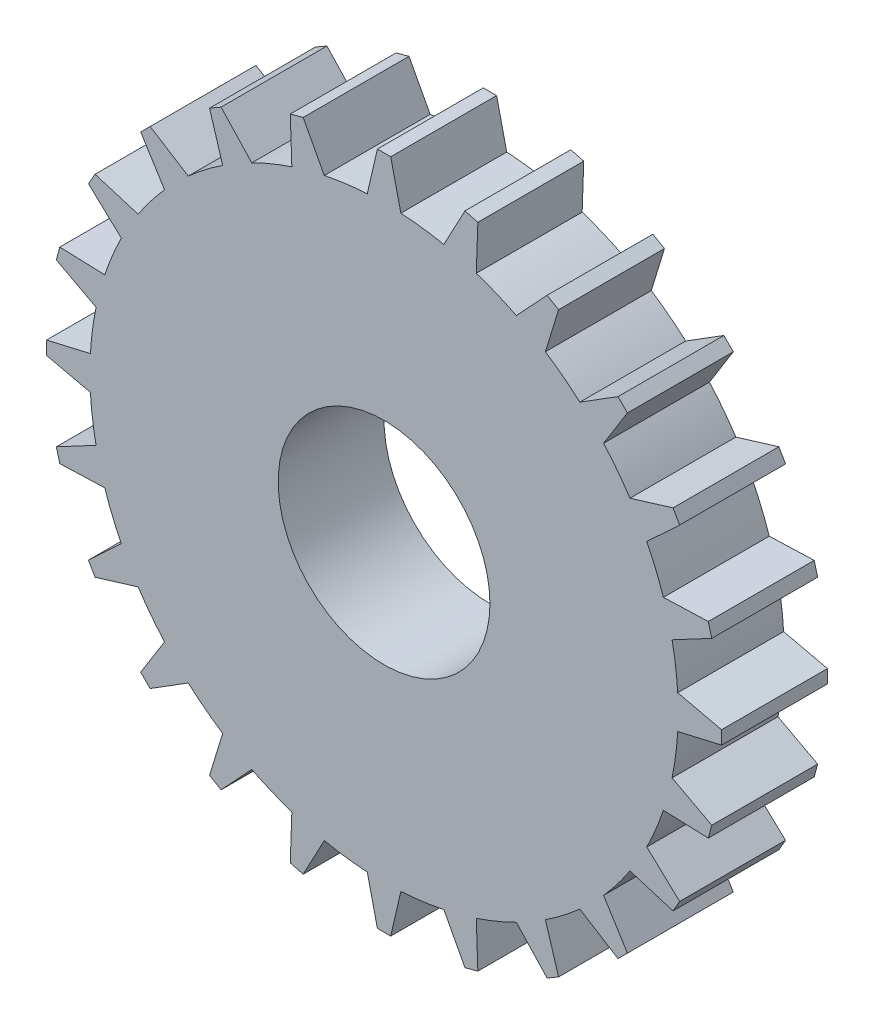
from build123d import *

# Parameters (mm, degrees)
CROQUIS1_R              = 44.1
CROQUIS1_R_2            = 15.875
SALIENTE_EXTRUIR1_DEPTH = 15.875
SALIENTE_EXTRUIR2_DEPTH = 15.875
MATRIZC1_DEPTH          = 15.875


# Read off the part's stored shape, not the designer's step: MatrizC1
with BuildPart() as part:
    # Croquis1 → Saliente-Extruir1 (new body)
    with BuildSketch(Plane.XY):
        Circle(CROQUIS1_R)
        Circle(CROQUIS1_R_2, mode=Mode.SUBTRACT)
    extrude(amount=SALIENTE_EXTRUIR1_DEPTH)

    # Croquis2 → Saliente-Extruir2 (add)
    with BuildSketch(Plane.XY.offset(15.875)):
        Polygon((-1, 50.6), (1, 50.6), (2.815859205, 42.731276779), (-2.815859205, 42.731276779), align=None)
    extrude(amount=-SALIENTE_EXTRUIR2_DEPTH)

    # MatrizC1 outline → MatrizC1 (add)
    with BuildSketch(Plane.XY):
        with BuildLine():
            ThreePointArc((-13.826153616, 41.876574313), (-11.413919889, 42.59732894), (-8.964486889, 43.179253987))
            Line((-8.964486889, 43.179253987), (-12.130317856, 49.134665855))
            Line((-12.130317856, 49.134665855), (-14.062169508, 48.617027765))
            Line((-14.062169508, 48.617027765), (-13.826153616, 41.876574313))
        make_face()
        with BuildLine():
            ThreePointArc((8.964486889, 43.179253987), (11.413919889, 42.59732894), (13.826153616, 41.876574313))
            Line((13.826153616, 41.876574313), (14.062169508, 48.617027765))
            Line((14.062169508, 48.617027765), (12.130317856, 49.134665855))
            Line((12.130317856, 49.134665855), (8.964486889, 43.179253987))
        make_face()
        with BuildLine():
            ThreePointArc((19.83464269, 39.387776649), (22.05, 38.191720307), (24.193493831, 36.87119277))
            Line((24.193493831, 36.87119277), (26.166025404, 43.320885431))
            Line((26.166025404, 43.320885431), (24.433974596, 44.320885431))
            Line((24.433974596, 44.320885431), (19.83464269, 39.387776649))
        make_face()
        with BuildLine():
            ThreePointArc((29.353100371, 32.912087424), (31.18340905, 31.18340905), (32.912087424, 29.353100371))
            Line((32.912087424, 29.353100371), (36.486709909, 35.072496347))
            Line((36.486709909, 35.072496347), (35.072496347, 36.486709909))
            Line((35.072496347, 36.486709909), (29.353100371, 32.912087424))
        make_face()
        with BuildLine():
            ThreePointArc((36.87119277, 24.193493831), (38.191720307, 22.05), (39.387776649, 19.83464269))
            Line((39.387776649, 19.83464269), (44.320885431, 24.433974596))
            Line((44.320885431, 24.433974596), (43.320885431, 26.166025404))
            Line((43.320885431, 26.166025404), (36.87119277, 24.193493831))
        make_face()
        with BuildLine():
            ThreePointArc((41.876574313, 13.826153616), (42.597328939, 11.413919889), (43.179253986, 8.964486889))
            Line((43.179253986, 8.964486889), (49.134665855, 12.130317856))
            Line((49.134665855, 12.130317856), (48.617027765, 14.062169508))
            Line((48.617027765, 14.062169508), (41.876574313, 13.826153616))
        make_face()
        with BuildLine():
            ThreePointArc((44.028136522, 2.51658388), (44.1, 0), (44.028136522, -2.51658388))
            Line((44.028136522, -2.51658388), (50.6, -1))
            Line((50.6, -1), (50.6, 1))
            Line((50.6, 1), (44.028136522, 2.51658388))
        make_face()
        with BuildLine():
            ThreePointArc((43.179253986, -8.964486889), (42.597328939, -11.413919889), (41.876574313, -13.826153616))
            Line((41.876574313, -13.826153616), (48.617027765, -14.062169508))
            Line((48.617027765, -14.062169508), (49.134665855, -12.130317856))
            Line((49.134665855, -12.130317856), (43.179253986, -8.964486889))
        make_face()
        with BuildLine():
            ThreePointArc((39.387776649, -19.83464269), (38.191720307, -22.05), (36.871192769, -24.193493831))
            Line((36.871192769, -24.193493831), (43.320885431, -26.166025404))
            Line((43.320885431, -26.166025404), (44.320885431, -24.433974596))
            Line((44.320885431, -24.433974596), (39.387776649, -19.83464269))
        make_face()
        with BuildLine():
            ThreePointArc((32.912087424, -29.353100371), (31.18340905, -31.18340905), (29.353100371, -32.912087424))
            Line((29.353100371, -32.912087424), (35.072496347, -36.486709909))
            Line((35.072496347, -36.486709909), (36.486709909, -35.072496347))
            Line((36.486709909, -35.072496347), (32.912087424, -29.353100371))
        make_face()
        with BuildLine():
            ThreePointArc((24.193493831, -36.871192769), (22.05, -38.191720307), (19.83464269, -39.387776649))
            Line((19.83464269, -39.387776649), (24.433974596, -44.320885431))
            Line((24.433974596, -44.320885431), (26.166025404, -43.320885431))
            Line((26.166025404, -43.320885431), (24.193493831, -36.871192769))
        make_face()
        with BuildLine():
            ThreePointArc((13.826153616, -41.876574313), (11.413919889, -42.597328939), (8.964486889, -43.179253986))
            Line((8.964486889, -43.179253986), (12.130317856, -49.134665855))
            Line((12.130317856, -49.134665855), (14.062169508, -48.617027765))
            Line((14.062169508, -48.617027765), (13.826153616, -41.876574313))
        make_face()
        with BuildLine():
            ThreePointArc((2.51658388, -44.028136522), (0, -44.1), (-2.51658388, -44.028136522))
            Line((-2.51658388, -44.028136522), (-1, -50.6))
            Line((-1, -50.6), (1, -50.6))
            Line((1, -50.6), (2.51658388, -44.028136522))
        make_face()
        with BuildLine():
            ThreePointArc((-8.964486889, -43.179253986), (-11.413919889, -42.597328939), (-13.826153616, -41.876574313))
            Line((-13.826153616, -41.876574313), (-14.062169508, -48.617027765))
            Line((-14.062169508, -48.617027765), (-12.130317856, -49.134665855))
            Line((-12.130317856, -49.134665855), (-8.964486889, -43.179253986))
        make_face()
        with BuildLine():
            ThreePointArc((-19.83464269, -39.387776649), (-22.05, -38.191720307), (-24.193493831, -36.871192769))
            Line((-24.193493831, -36.871192769), (-26.166025404, -43.320885431))
            Line((-26.166025404, -43.320885431), (-24.433974596, -44.320885431))
            Line((-24.433974596, -44.320885431), (-19.83464269, -39.387776649))
        make_face()
        with BuildLine():
            ThreePointArc((-29.353100371, -32.912087424), (-31.18340905, -31.18340905), (-32.912087424, -29.353100371))
            Line((-32.912087424, -29.353100371), (-36.486709909, -35.072496347))
            Line((-36.486709909, -35.072496347), (-35.072496347, -36.486709909))
            Line((-35.072496347, -36.486709909), (-29.353100371, -32.912087424))
        make_face()
        with BuildLine():
            ThreePointArc((-36.871192769, -24.193493831), (-38.191720307, -22.05), (-39.387776649, -19.83464269))
            Line((-39.387776649, -19.83464269), (-44.320885431, -24.433974596))
            Line((-44.320885431, -24.433974596), (-43.320885431, -26.166025404))
            Line((-43.320885431, -26.166025404), (-36.871192769, -24.193493831))
        make_face()
        with BuildLine():
            ThreePointArc((-41.876574313, -13.826153616), (-42.597328939, -11.413919889), (-43.179253986, -8.964486889))
            Line((-43.179253986, -8.964486889), (-49.134665855, -12.130317856))
            Line((-49.134665855, -12.130317856), (-48.617027765, -14.062169508))
            Line((-48.617027765, -14.062169508), (-41.876574313, -13.826153616))
        make_face()
        with BuildLine():
            ThreePointArc((-44.028136522, -2.51658388), (-44.1, 0), (-44.028136522, 2.51658388))
            Line((-44.028136522, 2.51658388), (-50.6, 1))
            Line((-50.6, 1), (-50.6, -1))
            Line((-50.6, -1), (-44.028136522, -2.51658388))
        make_face()
        with BuildLine():
            ThreePointArc((-43.179253986, 8.964486889), (-42.597328939, 11.413919889), (-41.876574313, 13.826153616))
            Line((-41.876574313, 13.826153616), (-48.617027765, 14.062169508))
            Line((-48.617027765, 14.062169508), (-49.134665855, 12.130317856))
            Line((-49.134665855, 12.130317856), (-43.179253986, 8.964486889))
        make_face()
        with BuildLine():
            ThreePointArc((-39.387776649, 19.83464269), (-38.191720307, 22.05), (-36.87119277, 24.193493831))
            Line((-36.87119277, 24.193493831), (-43.320885431, 26.166025404))
            Line((-43.320885431, 26.166025404), (-44.320885431, 24.433974596))
            Line((-44.320885431, 24.433974596), (-39.387776649, 19.83464269))
        make_face()
        with BuildLine():
            ThreePointArc((-32.912087424, 29.353100371), (-31.18340905, 31.18340905), (-29.353100371, 32.912087424))
            Line((-29.353100371, 32.912087424), (-35.072496347, 36.486709909))
            Line((-35.072496347, 36.486709909), (-36.486709909, 35.072496347))
            Line((-36.486709909, 35.072496347), (-32.912087424, 29.353100371))
        make_face()
        with BuildLine():
            ThreePointArc((-24.193493831, 36.87119277), (-22.05, 38.191720307), (-19.83464269, 39.387776649))
            Line((-19.83464269, 39.387776649), (-24.433974596, 44.320885431))
            Line((-24.433974596, 44.320885431), (-26.166025404, 43.320885431))
            Line((-26.166025404, 43.320885431), (-24.193493831, 36.87119277))
        make_face()
    extrude(amount=MATRIZC1_DEPTH)


solid = part.part
